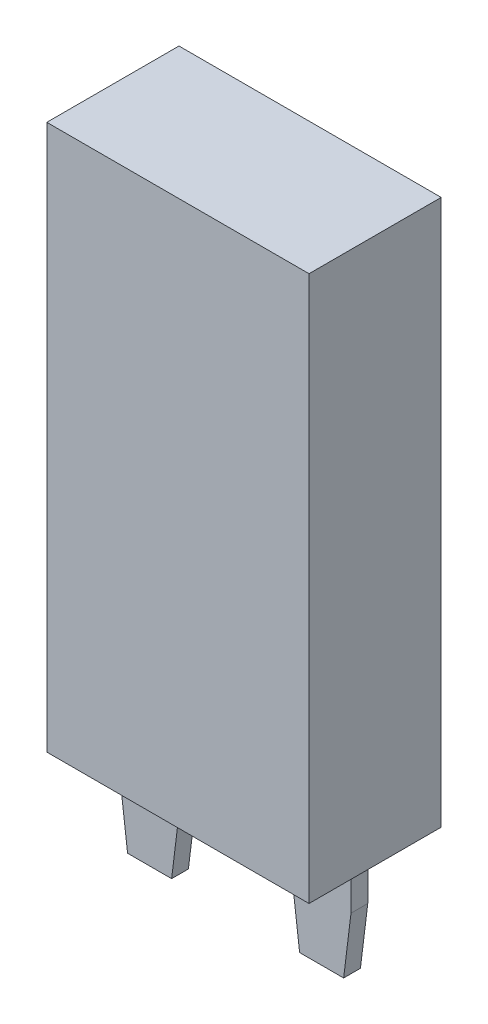
from build123d import *
from OCP.BRepFilletAPI import BRepFilletAPI_MakeChamfer

# Parameters (mm, degrees)
SKETCH1_W           = 12.5
SKETCH1_H           = 26
BOSS_EXTRUDE1_DEPTH = 3.15
SKETCH2_W           = 2.8
SKETCH2_H           = 0.8
BOSS_EXTRUDE2_DEPTH = 5
CHAMFER1_SIZE       = 0.35
CHAMFER1_SIZE2      = 2.85052125


with BuildPart() as part:
    # Sketch1 → Boss-Extrude1 (new, symmetric)
    with BuildSketch(Plane.XY):
        Rectangle(SKETCH1_W, SKETCH1_H)
    extrude(amount=BOSS_EXTRUDE1_DEPTH, both=True)

    # Sketch2 → Boss-Extrude2 (add)
    with BuildSketch(Plane.XZ.offset(13)):
        with Locations((4.1, 0)):
            Rectangle(SKETCH2_W, SKETCH2_H)
        with Locations((-4.1, 0)):
            Rectangle(SKETCH2_W, SKETCH2_H)
    extrude(amount=BOSS_EXTRUDE2_DEPTH)

    # Chamfer1: one chamfer whose edges measure the first distance from different faces: ONE call of the kernel's chamfer builder (chamfer() names one face for all edges)
    chamfer1_edges_1 = [part.edges().sort_by_distance(p)[0] for p in [
        (5.5, -18, 0),
        (2.7, -18, 0),
    ]]
    chamfer1_side_1 = [part.faces().sort_by_distance(p)[0] for p in [
        (4.1, -18, 0),
    ]]
    chamfer1_edges_2 = [part.edges().sort_by_distance(p)[0] for p in [
        (-2.7, -18, 0),
        (-5.5, -18, 0),
    ]]
    chamfer1_side_2 = [part.faces().sort_by_distance(p)[0] for p in [
        (-4.1, -18, 0),
    ]]
    chamfer1 = BRepFilletAPI_MakeChamfer(part.part.solid().wrapped)
    for e in chamfer1_edges_1:
        chamfer1.Add(CHAMFER1_SIZE, CHAMFER1_SIZE2, e.wrapped, chamfer1_side_1[0].wrapped)  # the first distance lies on this face
    for e in chamfer1_edges_2:
        chamfer1.Add(CHAMFER1_SIZE, CHAMFER1_SIZE2, e.wrapped, chamfer1_side_2[0].wrapped)  # the first distance lies on this face
    add(Compound.cast(chamfer1.Shape()), mode=Mode.REPLACE)


solid = part.part
